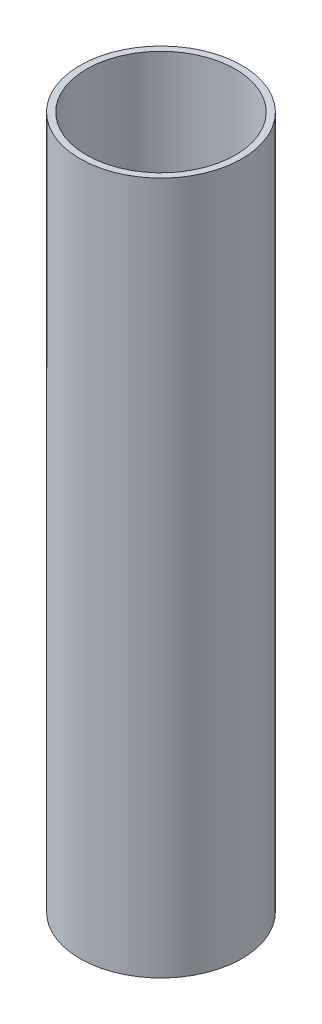
from build123d import *

# Parameters (mm, degrees)
SKETCH_1_R      = 25
SKETCH_1_R_2    = 23
EXTRUDE_1_DEPTH = 214


with BuildPart() as part:
    # Эскиз1 → Бобышка-Вытянуть1 (new body)
    with BuildSketch(Plane(origin=(0, 0, 0), x_dir=(1, 0, 0), z_dir=(0, 1, 0))):
        Circle(SKETCH_1_R)
        Circle(SKETCH_1_R_2, mode=Mode.SUBTRACT)
    extrude(amount=EXTRUDE_1_DEPTH)


solid = part.part
